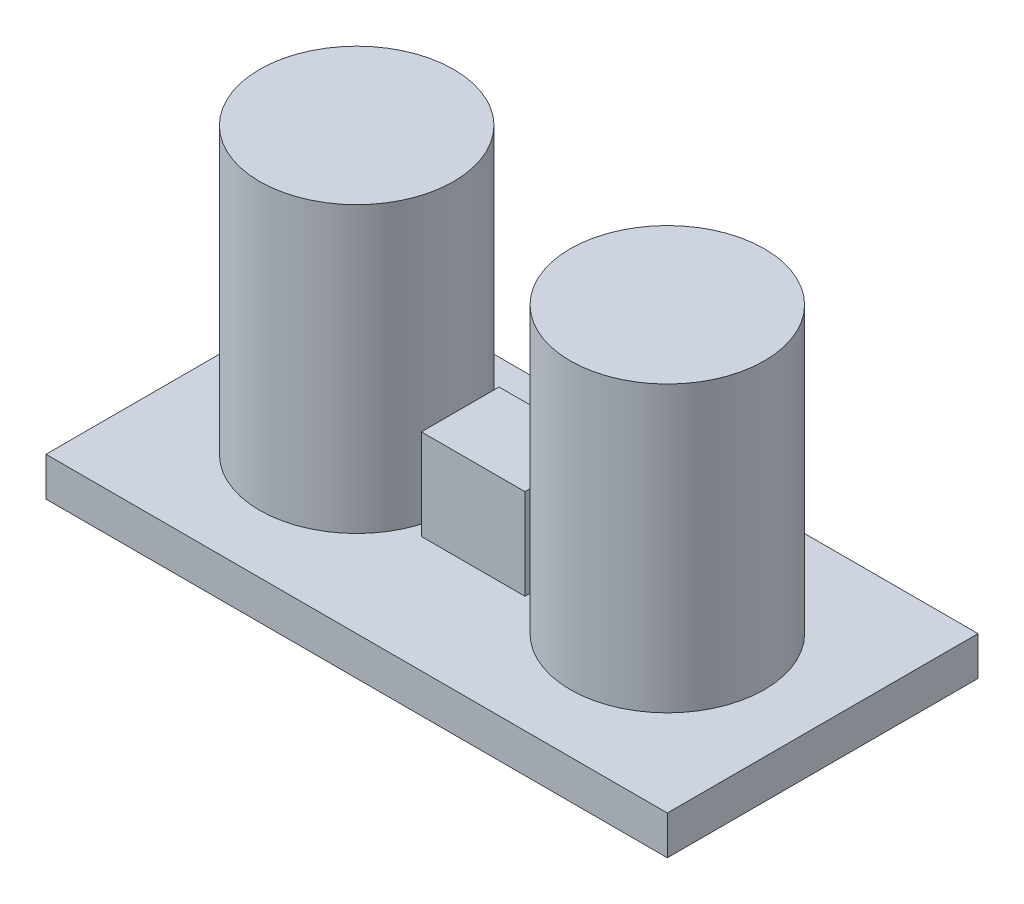
from build123d import *

# Parameters (mm, degrees)
SKETCH1_W           = 2400
SKETCH1_H           = 1200
BOSS_EXTRUDE1_DEPTH = 150
BOSS_EXTRUDE2_START = 150
SKETCH2_R           = 375
BOSS_EXTRUDE2_DEPTH = 1100
BOSS_EXTRUDE3_START = 150
SKETCH3_R           = 375
BOSS_EXTRUDE3_DEPTH = 1100
BOSS_EXTRUDE4_START = 150
SKETCH4_W           = 400
SKETCH4_H           = 300
BOSS_EXTRUDE4_DEPTH = 350


with BuildPart() as part:
    # Sketch1 → Boss-Extrude1 (new body)
    with BuildSketch(Plane(origin=(0, 0, 0), x_dir=(1, 0, 0), z_dir=(0, 1, 0))):
        with Locations((-3500, 1000)):
            Rectangle(SKETCH1_W, SKETCH1_H)
    extrude(amount=BOSS_EXTRUDE1_DEPTH)

    # Sketch2 → Boss-Extrude2 (add)
    with BuildSketch(Plane(origin=(0, 0, 0), x_dir=(1, 0, 0), z_dir=(0, 1, 0)).offset(BOSS_EXTRUDE2_START)):
        with Locations((-4100, 1000)):
            Circle(SKETCH2_R)
    extrude(amount=BOSS_EXTRUDE2_DEPTH)

    # Sketch3 → Boss-Extrude3 (add)
    with BuildSketch(Plane(origin=(0, 0, 0), x_dir=(1, 0, 0), z_dir=(0, 1, 0)).offset(BOSS_EXTRUDE3_START)):
        with Locations((-2900, 1000)):
            Circle(SKETCH3_R)
    extrude(amount=BOSS_EXTRUDE3_DEPTH)

    # Sketch4 → Boss-Extrude4 (add)
    with BuildSketch(Plane(origin=(0, 0, 0), x_dir=(1, 0, 0), z_dir=(0, 1, 0)).offset(BOSS_EXTRUDE4_START)):
        with Locations((-3500, 1000)):
            Rectangle(SKETCH4_W, SKETCH4_H)
    extrude(amount=BOSS_EXTRUDE4_DEPTH)


solid = part.part
